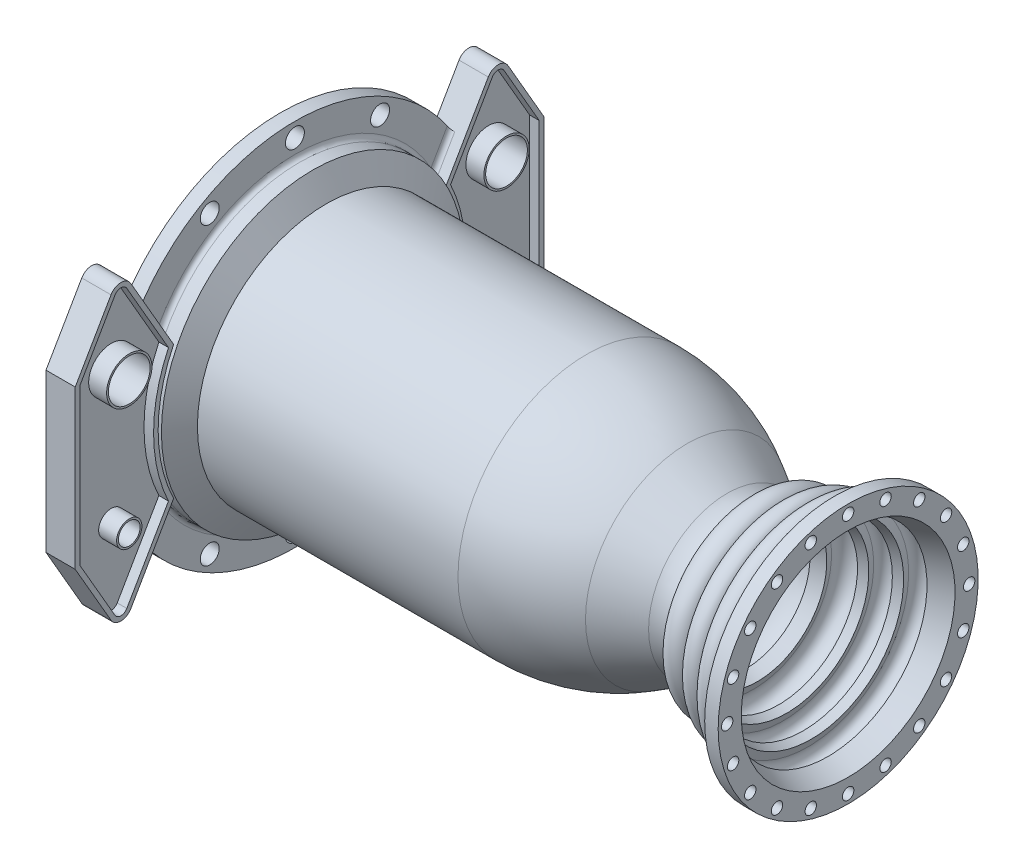
from build123d import *
from build123d.topology import SkipClean

# Parameters (mm, degrees)
BOSS_EXTRUDE1_DEPTH     = 16.256
CUT_EXTRUDE1_DEPTH      = 5.334
BOSS_EXTRUDE2_START     = -8.128
BOSS_EXTRUDE2_DEPTH     = 8.128
FILLET2_R               = 2.54
SKETCH9_R               = 5.275
CUT_EXTRUDE2_DEPTH      = 419.885269444
SKETCH10_R              = 11.6
SKETCH10_R_2            = 6.05
CUT_EXTRUDE3_DEPTH      = 417.321354466
BOSS_EXTRUDE3_START     = 10
SKETCH11_R              = 12.6
SKETCH11_R_2            = 11.6
SKETCH11_R_3            = 7.05
SKETCH11_R_4            = 6.05
BOSS_EXTRUDE3_DEPTH     = 10
CUT_EXTRUDE4_DEPTH      = 404.084600433
CUT_EXTRUDE4_DEPTH_BACK = 404.084600433
SKETCH17_W              = 85
SKETCH17_H              = 190
CUT_EXTRUDE5_REACH      = 358.824
SKETCH20_R              = 3.175


with BuildPart() as part:
    # Sketch3 → Revolve1 (revolve)
    with BuildSketch(Plane.XY):
        with BuildLine():
            Line((0, 71.5011717), (144.934666475, 71.5011717))
            ThreePointArc((144.934666475, 71.5011717), (173.892574508, 67.688769671), (200.877042723, 56.51141211))
            Line((200.877042723, 56.51141211), (223.127154881, 43.665279514))
            ThreePointArc((223.127154881, 43.665279514), (227.625034583, 41.721337074), (232.448772375, 40.860298318))
            add(Edge.make_bspline(
                [(232.448772375, 40.860298318), (234.86856203, 41.933657894), (240.173238318, 44.266655644), (251.176182965, 49.013937562), (265.440009786, 54.97345202), (282.448229164, 61.765962568), (299.354503113, 68.202057856), (316.156963457, 74.280596731), (332.857651733, 80.001884245), (346.685594207, 84.470267584), (357.704525634, 87.868146407), (363.182392167, 89.503083437), (365.9308663, 90.309661005)],
                knots=[0.492875979, 0.492875979, 0.492875979, 0.492875979, 0.492966882, 0.493074775, 0.493290561, 0.493506346, 0.493722132, 0.493937918, 0.494153704, 0.494369489, 0.494477382, 0.494585275, 0.494585275, 0.494585275, 0.494585275], degree=3))
            Line((365.9308663, 90.309661005), (367.338810321, 85.511985147))
            add(Edge.make_bspline(
                [(233.424633311, 35.822756061), (236.183141196, 37.049408729), (241.820242455, 39.531718175), (253.12775411, 44.410404122), (267.331680592, 50.344882311), (284.265598042, 57.10770533), (301.095145103, 63.51457761), (317.818383555, 69.564442688), (334.43732724, 75.257710839), (348.19495997, 79.703362784), (359.156425704, 83.083517043), (364.604957844, 84.709698506), (367.338810321, 85.511985147)],
                knots=[0.492862754, 0.492862754, 0.492862754, 0.492862754, 0.492966882, 0.493074775, 0.493290561, 0.493506346, 0.493722132, 0.493937918, 0.494153704, 0.494369489, 0.494477382, 0.494585275, 0.494585275, 0.494585275, 0.494585275], degree=3))
            ThreePointArc((233.424633311, 35.822756061), (226.800103593, 36.756276843), (220.627157517, 39.335150973))
            Line((220.627157517, 39.335150973), (198.377039169, 52.181287144))
            ThreePointArc((198.377039169, 52.181287144), (172.598474463, 62.859141831), (144.9346606, 66.5011717))
            Line((144.9346606, 66.5011717), (0, 66.5011717))
            Line((0, 66.5011717), (0, 71.5011717))
        make_face()
    revolve(axis=Axis((0, 0, 0), (1, 0, 0)))

    # Sketch4 → Revolve5 (revolve)
    with BuildSketch(Plane.XY):
        Polygon((-25.4, 66.5011717), (-25.4, 84.2011717), (-7.332348419, 84.2011717), (0, 71.5011717), (0, 66.5011717), align=None)
    revolve(axis=Axis((0, 0, 0), (1, 0, 0)))

    # Sketch6 → Boss-Extrude1 (add)
    with SkipClean():  # the faces are left unmerged after this step: merging them gives an invalid solid
        with BuildSketch(Plane.ZY.offset(25.4)):
            with BuildLine():
                Line((64.197098299, 17.35333995), (99.428641487, 78.37616278))
                ThreePointArc((99.428641487, 78.37616278), (104.927902801, 81.55116278), (110.427164115, 78.37616278))
                Line((110.427164115, 78.37616278), (130.327902801, 43.907072268))
                Line((130.327902801, 43.907072268), (130.327902801, -43.907072268))
                Line((130.327902801, -43.907072268), (110.427164115, -78.37616278))
                ThreePointArc((110.427164115, -78.37616278), (104.927902801, -81.55116278), (99.428641487, -78.37616278))
                Line((99.428641487, -78.37616278), (64.197098299, -17.35333995))
                ThreePointArc((64.197098299, -17.35333995), (66.5011717, 0), (64.197098299, 17.35333995))
            make_face()
            with BuildLine():
                Line((-64.197098299, -17.35333995), (-99.428641487, -78.37616278))
                ThreePointArc((-99.428641487, -78.37616278), (-104.927902801, -81.55116278), (-110.427164115, -78.37616278))
                Line((-110.427164115, -78.37616278), (-130.327902801, -43.907072268))
                Line((-130.327902801, -43.907072268), (-130.327902801, 43.907072268))
                Line((-130.327902801, 43.907072268), (-110.427164115, 78.37616278))
                ThreePointArc((-110.427164115, 78.37616278), (-104.927902801, 81.55116278), (-99.428641487, 78.37616278))
                Line((-99.428641487, 78.37616278), (-64.197098299, 17.35333995))
                ThreePointArc((-64.197098299, 17.35333995), (-66.5011717, 0), (-64.197098299, -17.35333995))
            make_face()
        extrude(amount=-BOSS_EXTRUDE1_DEPTH)

    # Sketch7 → Cut-Extrude1 (cut)
    with SkipClean():  # the faces are left unmerged after this step: merging them gives an invalid solid
        with BuildSketch(Plane(origin=(-9.144, 0, 0), x_dir=(0, 0, -1), z_dir=(1, 0, 0))):
            with BuildLine():
                Line((-78.462562562, 36.981848846), (-101.628346013, 77.10616278))
                ThreePointArc((-101.628346013, 77.10616278), (-104.927902801, 79.01116278), (-108.22745959, 77.10616278))
                Line((-108.22745959, 77.10616278), (-127.787902801, 43.226481319))
                Line((-127.787902801, 43.226481319), (-127.787902801, -43.226481319))
                Line((-127.787902801, -43.226481319), (-108.22745959, -77.10616278))
                ThreePointArc((-108.22745959, -77.10616278), (-104.927902801, -79.01116278), (-101.628346013, -77.10616278))
                Line((-101.628346013, -77.10616278), (-78.462562562, -36.981848846))
                ThreePointArc((-78.462562562, -36.981848846), (-86.7411717, 0), (-78.462562562, 36.981848846))
            make_face()
            with BuildLine():
                Line((101.628346013, -77.10616278), (78.462562562, -36.981848846))
                ThreePointArc((78.462562562, -36.981848846), (86.7411717, 0), (78.462562562, 36.981848846))
                Line((78.462562562, 36.981848846), (101.628346013, 77.10616278))
                ThreePointArc((101.628346013, 77.10616278), (104.927902801, 79.01116278), (108.22745959, 77.10616278))
                Line((108.22745959, 77.10616278), (127.787902801, 43.226481319))
                Line((127.787902801, 43.226481319), (127.787902801, -43.226481319))
                Line((127.787902801, -43.226481319), (108.22745959, -77.10616278))
                ThreePointArc((108.22745959, -77.10616278), (104.927902801, -79.01116278), (101.628346013, -77.10616278))
            make_face()
        extrude(amount=-CUT_EXTRUDE1_DEPTH, mode=Mode.SUBTRACT)

    # Sketch8 → Boss-Extrude2 (add)
    with SkipClean():  # the faces are left unmerged after this step: merging them gives an invalid solid
        with BuildSketch(Plane.ZY.offset(25.4).offset(BOSS_EXTRUDE2_START)):
            with BuildLine():
                Line((-75.592096587, 37.090055935), (-86.329826389, 55.688349511))
                ThreePointArc((-86.329826389, 55.688349511), (0, 102.7328146), (86.329826389, 55.688349511))
                Line((86.329826389, 55.688349511), (75.592096587, 37.090055935))
                ThreePointArc((75.592096587, 37.090055935), (0, 84.2011717), (-75.592096587, 37.090055935))
            make_face()
            with BuildLine():
                Line((86.329826389, -55.688349511), (75.592096587, -37.090055935))
                ThreePointArc((75.592096587, -37.090055935), (0, -84.2011717), (-75.592096587, -37.090055935))
                Line((-75.592096587, -37.090055935), (-86.329826389, -55.688349511))
                ThreePointArc((-86.329826389, -55.688349511), (0, -102.7328146), (86.329826389, -55.688349511))
            make_face()
        extrude(amount=BOSS_EXTRUDE2_DEPTH)

    # Fillet2
    fillet2_edges = [part.edges().sort_by_distance(p)[0] for p in [
        (-17.272, 46.389202723, 80.960961488),
        (-17.272, 71.459301297, 44.535441771),
        (-17.272, 46.389202723, -80.960961488),
        (-17.272, -46.389202723, -80.960961488),
        (-17.272, -84.2011717, 0),
        (-17.272, -46.389202723, 80.960961488),
    ]]
    fillet(fillet2_edges, radius=FILLET2_R)

    # Sketch9 → Cut-Extrude2 (cut, through all)
    with SkipClean():  # the faces are left unmerged after this step: merging them gives an invalid solid
        with BuildSketch(Plane(origin=(-17.272, 0, 0), x_dir=(0, 0, -1), z_dir=(1, 0, 0))):
            with Locations((0, 94.73699315)):
                Circle(SKETCH9_R)
            with Locations((-47.368496575, 82.044642746)):
                Circle(SKETCH9_R)
            with Locations((47.368496575, 82.044642746)):
                Circle(SKETCH9_R)
            with Locations((47.368496575, -82.044642746)):
                Circle(SKETCH9_R)
            with Locations((0, -94.73699315)):
                Circle(SKETCH9_R)
            with Locations((-47.368496575, -82.044642746)):
                Circle(SKETCH9_R)
        extrude(amount=-CUT_EXTRUDE2_DEPTH, mode=Mode.SUBTRACT)

    # Sketch10 → Cut-Extrude3 (cut, through all)
    with SkipClean():  # the faces are left unmerged after this step: merging them gives an invalid solid
        with BuildSketch(Plane(origin=(-14.478, 0, 0), x_dir=(0, 0, -1), z_dir=(1, 0, 0))):
            with Locations((-104.927902801, 36.981848846)):
                Circle(SKETCH10_R)
            with Locations((-104.927902801, -36.981848846)):
                Circle(SKETCH10_R_2)
            with Locations((104.927902801, -36.981848846)):
                Circle(SKETCH10_R_2)
            with Locations((104.927902801, 36.981848846)):
                Circle(SKETCH10_R)
        extrude(amount=-CUT_EXTRUDE3_DEPTH, mode=Mode.SUBTRACT)

    # Sketch11 → Boss-Extrude3 (add)
    # profile 1 of 4: a face of its own
    with SkipClean():  # the faces are left unmerged after this step: merging them gives an invalid solid
        with BuildSketch(Plane(origin=(-14.478, 0, 0), x_dir=(0, 0, -1), z_dir=(1, 0, 0)).offset(BOSS_EXTRUDE3_START)):
            with Locations((-104.927902801, 36.981848846)):
                Circle(SKETCH11_R)
            with Locations((-104.927902801, 36.981848846)):
                Circle(SKETCH11_R_2, mode=Mode.SUBTRACT)
        # profile 2 of 4: a face of its own
        with BuildSketch(Plane(origin=(-14.478, 0, 0), x_dir=(0, 0, -1), z_dir=(1, 0, 0)).offset(BOSS_EXTRUDE3_START)):
            with Locations((-104.927902801, -36.981848846)):
                Circle(SKETCH11_R_3)
            with Locations((-104.927902801, -36.981848846)):
                Circle(SKETCH11_R_4, mode=Mode.SUBTRACT)
        # profile 3 of 4: a face of its own
        with BuildSketch(Plane(origin=(-14.478, 0, 0), x_dir=(0, 0, -1), z_dir=(1, 0, 0)).offset(BOSS_EXTRUDE3_START)):
            with Locations((104.927902801, -36.981848846)):
                Circle(SKETCH11_R_3)
            with Locations((104.927902801, -36.981848846)):
                Circle(SKETCH11_R_4, mode=Mode.SUBTRACT)
        # profile 4 of 4: a face of its own
        with BuildSketch(Plane(origin=(-14.478, 0, 0), x_dir=(0, 0, -1), z_dir=(1, 0, 0)).offset(BOSS_EXTRUDE3_START)):
            with Locations((104.927902801, 36.981848846)):
                Circle(SKETCH11_R)
            with Locations((104.927902801, 36.981848846)):
                Circle(SKETCH11_R_2, mode=Mode.SUBTRACT)
        extrude(amount=-BOSS_EXTRUDE3_DEPTH)

    # Sketch17 → Cut-Extrude4 (cut, two sides: drawn at the far end of the back side and taken through both)
    with SkipClean():  # the faces are left unmerged after this step: merging them gives an invalid solid
        with BuildSketch(Plane.XY.offset(-CUT_EXTRUDE4_DEPTH_BACK)):
            with Locations((332.986, 0)):
                Rectangle(SKETCH17_W, SKETCH17_H)
        extrude(amount=CUT_EXTRUDE4_DEPTH + CUT_EXTRUDE4_DEPTH_BACK, mode=Mode.SUBTRACT)

    # Sketch18 → Revolve7 (revolve)
    with SkipClean():  # the faces are left unmerged after this step: merging them gives an invalid solid
        with BuildSketch(Plane.XY):
            with BuildLine():
                Line((290.486, 64.812548202), (290.486, 72.312548202))
                Line((290.486, 72.312548202), (282.986, 72.312548202))
                Line((282.986, 72.312548202), (282.986, 61.922779567))
                add(Edge.make_bspline(
                    [(290.486, 64.812548202), (287.989354003, 63.860960223), (285.489344982, 62.897698501), (282.986, 61.922779567)],
                    knots=[0.493835272, 0.493835272, 0.493835272, 0.493835272, 0.493930858, 0.493930858, 0.493930858, 0.493930858], degree=3))
            make_face()
        revolve(axis=Axis((0, 0, 0), (1, 0, 0)))

    # Sketch13 → Revolve6 (revolve)
    with SkipClean():  # the faces are left unmerged after this step: merging them gives an invalid solid
        with BuildSketch(Plane.XY):
            with BuildLine():
                Line((253.452894778, 49.926348503), (264.534326054, 54.53089852))
                ThreePointArc((264.534326054, 54.53089852), (256.691335407, 57.76933915), (253.452894778, 49.926348503))
            make_face()
            with BuildLine():
                Line((237.023320854, 42.878591235), (250.795528896, 48.822161344))
                ThreePointArc((250.795528896, 48.822161344), (240.940832573, 52.729082189), (237.023320854, 42.878591235))
            make_face()
            with BuildLine():
                Line((267.191691936, 55.635085679), (278.330896767, 60.097947001))
                ThreePointArc((278.330896767, 60.097947001), (270.524021325, 63.450701173), (267.191691936, 55.635085679))
            make_face()
        revolve(axis=Axis((0, 0, 0), (1, 0, 0)))

    # Sketch19 → Cut-Revolve1 (revolve, cut)
    with SkipClean():  # the faces are left unmerged after this step: merging them gives an invalid solid
        with BuildSketch(Plane.XY):
            with BuildLine():
                Line((237.945873974, 43.276730671), (239.927065155, 38.685992005))
                Line((239.927065155, 38.685992005), (251.858568202, 43.835182654))
                Line((251.858568202, 43.835182654), (249.877377021, 48.42592132))
                ThreePointArc((249.877377021, 48.42592132), (241.337030173, 51.817077519), (237.945873974, 43.276730671))
            make_face()
            with BuildLine():
                Line((254.369462652, 50.326700303), (256.288085496, 45.709462343))
                Line((256.288085496, 45.709462343), (265.522511147, 49.546687142))
                Line((265.522511147, 49.546687142), (263.603888303, 54.163925102))
                ThreePointArc((263.603888303, 54.163925102), (257.068063078, 56.862525528), (254.369462652, 50.326700303))
            make_face()
            with BuildLine():
                Line((268.119962179, 56.006992061), (270.150419973, 50.939013551))
                Line((270.150419973, 50.939013551), (279.433084319, 54.65806211))
                Line((279.433084319, 54.65806211), (277.402626525, 59.72604062))
                ThreePointArc((277.402626525, 59.72604062), (270.901770072, 62.507848513), (268.119962179, 56.006992061))
            make_face()
        revolve(axis=Axis((0, 0, 0), (1, 0, 0)), mode=Mode.SUBTRACT)

    # Sketch20 → Cut-Extrude5 (cut, up to next)
    with BuildSketch(Plane(origin=(290.486, 0, 0), x_dir=(0, 0, -1), z_dir=(1, 0, 0)), mode=Mode.PRIVATE) as cut_extrude5_sk1:
        with Locations((0, 67.31)):
            Circle(SKETCH20_R)
    cut_extrude5_tool1 = extrude(cut_extrude5_sk1.sketch, amount=-CUT_EXTRUDE5_REACH, mode=Mode.PRIVATE) & part.part
    # Sketch20 → Cut-Extrude5 (cut, up to next)
    with BuildSketch(Plane(origin=(290.486, 0, 0), x_dir=(0, 0, -1), z_dir=(1, 0, 0)), mode=Mode.PRIVATE) as cut_extrude5_sk2:
        with Locations((20.799933891, 64.015614112)):
            Circle(SKETCH20_R)
    cut_extrude5_tool2 = extrude(cut_extrude5_sk2.sketch, amount=-CUT_EXTRUDE5_REACH, mode=Mode.PRIVATE) & part.part
    # Sketch20 → Cut-Extrude5 (cut, up to next)
    with BuildSketch(Plane(origin=(290.486, 0, 0), x_dir=(0, 0, -1), z_dir=(1, 0, 0)), mode=Mode.PRIVATE) as cut_extrude5_sk3:
        with Locations((39.563825332, 54.454933891)):
            Circle(SKETCH20_R)
    cut_extrude5_tool3 = extrude(cut_extrude5_sk3.sketch, amount=-CUT_EXTRUDE5_REACH, mode=Mode.PRIVATE) & part.part
    # Sketch20 → Cut-Extrude5 (cut, up to next)
    with BuildSketch(Plane(origin=(290.486, 0, 0), x_dir=(0, 0, -1), z_dir=(1, 0, 0)), mode=Mode.PRIVATE) as cut_extrude5_sk4:
        with Locations((54.454933891, 39.563825332)):
            Circle(SKETCH20_R)
    cut_extrude5_tool4 = extrude(cut_extrude5_sk4.sketch, amount=-CUT_EXTRUDE5_REACH, mode=Mode.PRIVATE) & part.part
    # Sketch20 → Cut-Extrude5 (cut, up to next)
    with BuildSketch(Plane(origin=(290.486, 0, 0), x_dir=(0, 0, -1), z_dir=(1, 0, 0)), mode=Mode.PRIVATE) as cut_extrude5_sk5:
        with Locations((64.015614112, 20.799933891)):
            Circle(SKETCH20_R)
    cut_extrude5_tool5 = extrude(cut_extrude5_sk5.sketch, amount=-CUT_EXTRUDE5_REACH, mode=Mode.PRIVATE) & part.part
    # Sketch20 → Cut-Extrude5 (cut, up to next)
    with BuildSketch(Plane(origin=(290.486, 0, 0), x_dir=(0, 0, -1), z_dir=(1, 0, 0)), mode=Mode.PRIVATE) as cut_extrude5_sk6:
        with Locations((67.31, 0)):
            Circle(SKETCH20_R)
    cut_extrude5_tool6 = extrude(cut_extrude5_sk6.sketch, amount=-CUT_EXTRUDE5_REACH, mode=Mode.PRIVATE) & part.part
    # Sketch20 → Cut-Extrude5 (cut, up to next)
    with BuildSketch(Plane(origin=(290.486, 0, 0), x_dir=(0, 0, -1), z_dir=(1, 0, 0)), mode=Mode.PRIVATE) as cut_extrude5_sk7:
        with Locations((64.015614112, -20.799933891)):
            Circle(SKETCH20_R)
    cut_extrude5_tool7 = extrude(cut_extrude5_sk7.sketch, amount=-CUT_EXTRUDE5_REACH, mode=Mode.PRIVATE) & part.part
    # Sketch20 → Cut-Extrude5 (cut, up to next)
    with BuildSketch(Plane(origin=(290.486, 0, 0), x_dir=(0, 0, -1), z_dir=(1, 0, 0)), mode=Mode.PRIVATE) as cut_extrude5_sk8:
        with Locations((54.454933891, -39.563825332)):
            Circle(SKETCH20_R)
    cut_extrude5_tool8 = extrude(cut_extrude5_sk8.sketch, amount=-CUT_EXTRUDE5_REACH, mode=Mode.PRIVATE) & part.part
    # Sketch20 → Cut-Extrude5 (cut, up to next)
    with BuildSketch(Plane(origin=(290.486, 0, 0), x_dir=(0, 0, -1), z_dir=(1, 0, 0)), mode=Mode.PRIVATE) as cut_extrude5_sk9:
        with Locations((39.563825332, -54.454933891)):
            Circle(SKETCH20_R)
    cut_extrude5_tool9 = extrude(cut_extrude5_sk9.sketch, amount=-CUT_EXTRUDE5_REACH, mode=Mode.PRIVATE) & part.part
    # Sketch20 → Cut-Extrude5 (cut, up to next)
    with BuildSketch(Plane(origin=(290.486, 0, 0), x_dir=(0, 0, -1), z_dir=(1, 0, 0)), mode=Mode.PRIVATE) as cut_extrude5_sk10:
        with Locations((20.799933891, -64.015614112)):
            Circle(SKETCH20_R)
    cut_extrude5_tool10 = extrude(cut_extrude5_sk10.sketch, amount=-CUT_EXTRUDE5_REACH, mode=Mode.PRIVATE) & part.part
    # Sketch20 → Cut-Extrude5 (cut, up to next)
    with BuildSketch(Plane(origin=(290.486, 0, 0), x_dir=(0, 0, -1), z_dir=(1, 0, 0)), mode=Mode.PRIVATE) as cut_extrude5_sk11:
        with Locations((0, -67.31)):
            Circle(SKETCH20_R)
    cut_extrude5_tool11 = extrude(cut_extrude5_sk11.sketch, amount=-CUT_EXTRUDE5_REACH, mode=Mode.PRIVATE) & part.part
    # Sketch20 → Cut-Extrude5 (cut, up to next)
    with BuildSketch(Plane(origin=(290.486, 0, 0), x_dir=(0, 0, -1), z_dir=(1, 0, 0)), mode=Mode.PRIVATE) as cut_extrude5_sk12:
        with Locations((-20.799933891, -64.015614112)):
            Circle(SKETCH20_R)
    cut_extrude5_tool12 = extrude(cut_extrude5_sk12.sketch, amount=-CUT_EXTRUDE5_REACH, mode=Mode.PRIVATE) & part.part
    # Sketch20 → Cut-Extrude5 (cut, up to next)
    with BuildSketch(Plane(origin=(290.486, 0, 0), x_dir=(0, 0, -1), z_dir=(1, 0, 0)), mode=Mode.PRIVATE) as cut_extrude5_sk13:
        with Locations((-39.563825332, -54.454933891)):
            Circle(SKETCH20_R)
    cut_extrude5_tool13 = extrude(cut_extrude5_sk13.sketch, amount=-CUT_EXTRUDE5_REACH, mode=Mode.PRIVATE) & part.part
    # Sketch20 → Cut-Extrude5 (cut, up to next)
    with BuildSketch(Plane(origin=(290.486, 0, 0), x_dir=(0, 0, -1), z_dir=(1, 0, 0)), mode=Mode.PRIVATE) as cut_extrude5_sk14:
        with Locations((-54.454933891, -39.563825332)):
            Circle(SKETCH20_R)
    cut_extrude5_tool14 = extrude(cut_extrude5_sk14.sketch, amount=-CUT_EXTRUDE5_REACH, mode=Mode.PRIVATE) & part.part
    # Sketch20 → Cut-Extrude5 (cut, up to next)
    with BuildSketch(Plane(origin=(290.486, 0, 0), x_dir=(0, 0, -1), z_dir=(1, 0, 0)), mode=Mode.PRIVATE) as cut_extrude5_sk15:
        with Locations((-64.015614112, -20.799933891)):
            Circle(SKETCH20_R)
    cut_extrude5_tool15 = extrude(cut_extrude5_sk15.sketch, amount=-CUT_EXTRUDE5_REACH, mode=Mode.PRIVATE) & part.part
    # Sketch20 → Cut-Extrude5 (cut, up to next)
    with BuildSketch(Plane(origin=(290.486, 0, 0), x_dir=(0, 0, -1), z_dir=(1, 0, 0)), mode=Mode.PRIVATE) as cut_extrude5_sk16:
        with Locations((-67.31, 0)):
            Circle(SKETCH20_R)
    cut_extrude5_tool16 = extrude(cut_extrude5_sk16.sketch, amount=-CUT_EXTRUDE5_REACH, mode=Mode.PRIVATE) & part.part
    # Sketch20 → Cut-Extrude5 (cut, up to next)
    with BuildSketch(Plane(origin=(290.486, 0, 0), x_dir=(0, 0, -1), z_dir=(1, 0, 0)), mode=Mode.PRIVATE) as cut_extrude5_sk17:
        with Locations((-64.015614112, 20.799933891)):
            Circle(SKETCH20_R)
    cut_extrude5_tool17 = extrude(cut_extrude5_sk17.sketch, amount=-CUT_EXTRUDE5_REACH, mode=Mode.PRIVATE) & part.part
    # Sketch20 → Cut-Extrude5 (cut, up to next)
    with BuildSketch(Plane(origin=(290.486, 0, 0), x_dir=(0, 0, -1), z_dir=(1, 0, 0)), mode=Mode.PRIVATE) as cut_extrude5_sk18:
        with Locations((-54.454933891, 39.563825332)):
            Circle(SKETCH20_R)
    cut_extrude5_tool18 = extrude(cut_extrude5_sk18.sketch, amount=-CUT_EXTRUDE5_REACH, mode=Mode.PRIVATE) & part.part
    # Sketch20 → Cut-Extrude5 (cut, up to next)
    with BuildSketch(Plane(origin=(290.486, 0, 0), x_dir=(0, 0, -1), z_dir=(1, 0, 0)), mode=Mode.PRIVATE) as cut_extrude5_sk19:
        with Locations((-39.563825332, 54.454933891)):
            Circle(SKETCH20_R)
    cut_extrude5_tool19 = extrude(cut_extrude5_sk19.sketch, amount=-CUT_EXTRUDE5_REACH, mode=Mode.PRIVATE) & part.part
    # Sketch20 → Cut-Extrude5 (cut, up to next)
    with BuildSketch(Plane(origin=(290.486, 0, 0), x_dir=(0, 0, -1), z_dir=(1, 0, 0)), mode=Mode.PRIVATE) as cut_extrude5_sk20:
        with Locations((-20.799933891, 64.015614112)):
            Circle(SKETCH20_R)
    cut_extrude5_tool20 = extrude(cut_extrude5_sk20.sketch, amount=-CUT_EXTRUDE5_REACH, mode=Mode.PRIVATE) & part.part
    add(cut_extrude5_tool1.solids().sort_by_distance((290.486, 67.31, 0))[0], mode=Mode.SUBTRACT)
    add(cut_extrude5_tool2.solids().sort_by_distance((290.486, 64.015614, -20.799934))[0], mode=Mode.SUBTRACT)
    add(cut_extrude5_tool3.solids().sort_by_distance((290.486, 54.454934, -39.563825))[0], mode=Mode.SUBTRACT)
    add(cut_extrude5_tool4.solids().sort_by_distance((290.486, 39.563825, -54.454934))[0], mode=Mode.SUBTRACT)
    add(cut_extrude5_tool5.solids().sort_by_distance((290.486, 20.799934, -64.015614))[0], mode=Mode.SUBTRACT)
    add(cut_extrude5_tool6.solids().sort_by_distance((290.486, 0, -67.31))[0], mode=Mode.SUBTRACT)
    add(cut_extrude5_tool7.solids().sort_by_distance((290.486, -20.799934, -64.015614))[0], mode=Mode.SUBTRACT)
    add(cut_extrude5_tool8.solids().sort_by_distance((290.486, -39.563825, -54.454934))[0], mode=Mode.SUBTRACT)
    add(cut_extrude5_tool9.solids().sort_by_distance((290.486, -54.454934, -39.563825))[0], mode=Mode.SUBTRACT)
    add(cut_extrude5_tool10.solids().sort_by_distance((290.486, -64.015614, -20.799934))[0], mode=Mode.SUBTRACT)
    add(cut_extrude5_tool11.solids().sort_by_distance((290.486, -67.31, 0))[0], mode=Mode.SUBTRACT)
    add(cut_extrude5_tool12.solids().sort_by_distance((290.486, -64.015614, 20.799934))[0], mode=Mode.SUBTRACT)
    add(cut_extrude5_tool13.solids().sort_by_distance((290.486, -54.454934, 39.563825))[0], mode=Mode.SUBTRACT)
    add(cut_extrude5_tool14.solids().sort_by_distance((290.486, -39.563825, 54.454934))[0], mode=Mode.SUBTRACT)
    add(cut_extrude5_tool15.solids().sort_by_distance((290.486, -20.799934, 64.015614))[0], mode=Mode.SUBTRACT)
    add(cut_extrude5_tool16.solids().sort_by_distance((290.486, 0, 67.31))[0], mode=Mode.SUBTRACT)
    add(cut_extrude5_tool17.solids().sort_by_distance((290.486, 20.799934, 64.015614))[0], mode=Mode.SUBTRACT)
    add(cut_extrude5_tool18.solids().sort_by_distance((290.486, 39.563825, 54.454934))[0], mode=Mode.SUBTRACT)
    add(cut_extrude5_tool19.solids().sort_by_distance((290.486, 54.454934, 39.563825))[0], mode=Mode.SUBTRACT)
    add(cut_extrude5_tool20.solids().sort_by_distance((290.486, 64.015614, 20.799934))[0], mode=Mode.SUBTRACT)


solid = part.part
